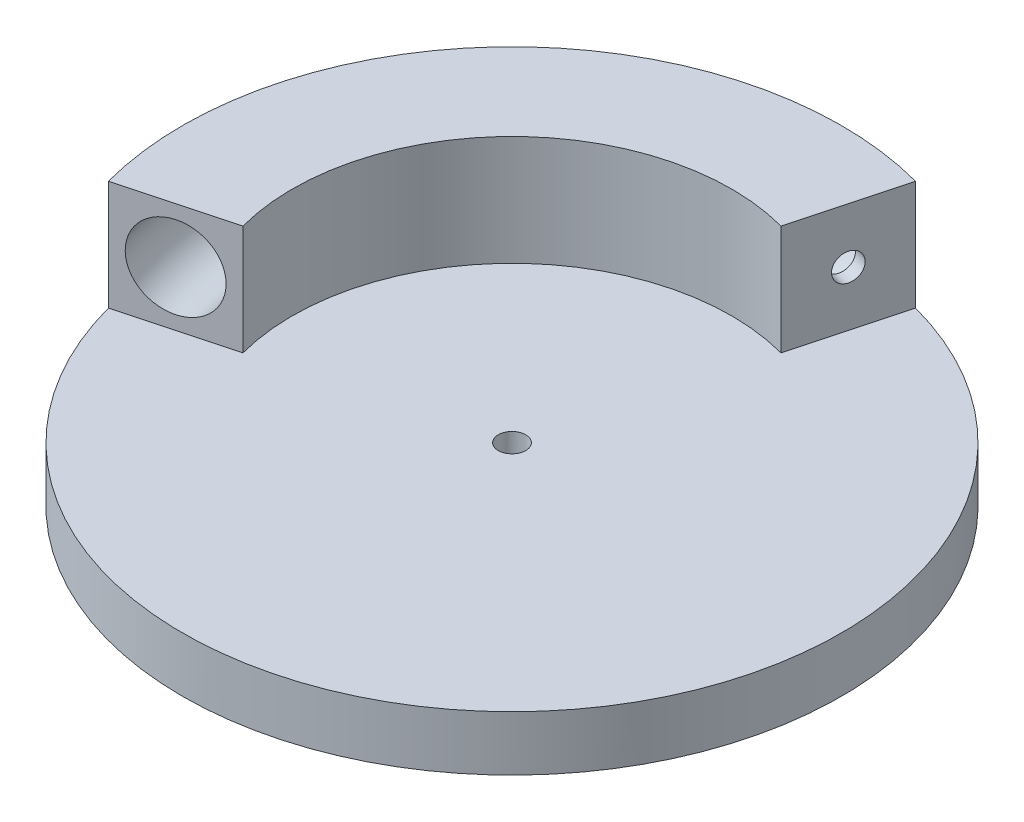
from build123d import *

# Parameters (mm, degrees)
SKETCH1_R                = 38.1
BOSS_EXTRUDE1_DEPTH      = 6.35
BOSS_EXTRUDE2_DEPTH      = 12.7
CUT_REVOLVE1_OUTLINE_R   = 4.7625
CUT_REVOLVE1_START       = -1.5875
CUT_REVOLVE1_2_OUTLINE_W = 11
CUT_REVOLVE1_2_OUTLINE_H = 11
CUT_REVOLVE1_2_DEPTH     = 1.5875
CUT_EXTRUDE2_REACH       = 59.15
SKETCH5_R                = 1.5875
CUT_EXTRUDE3_REACH       = 57.358
SKETCH6_R                = 1.5875


with BuildPart() as part:
    # Sketch1 → Boss-Extrude1 (new body)
    with BuildSketch(Plane(origin=(0, 0, 0), x_dir=(1, 0, 0), z_dir=(0, 1, 0))):
        with Locations(Location((0, 0, 0), (0, 0, 270))):
            Circle(SKETCH1_R)
    extrude(amount=BOSS_EXTRUDE1_DEPTH)

    # Sketch2 → Boss-Extrude2 (add)
    with BuildSketch(Plane(origin=(0, 6.35, 0), x_dir=(1, 0, 0), z_dir=(0, 1, 0))):
        with BuildLine():
            ThreePointArc((9.861005618, 36.801773982), (-26.940768363, 26.940768363), (-36.801773982, -9.861005618))
            Line((-36.801773982, -9.861005618), (-24.534515988, -6.574003746))
            ThreePointArc((-24.534515988, -6.574003746), (-17.960512242, 17.960512242), (6.574003746, 24.534515988))
            Line((6.574003746, 24.534515988), (9.861005618, 36.801773982))
        make_face()
    extrude(amount=BOSS_EXTRUDE2_DEPTH)

    # Cut-Revolve1: read off the stored shape, not the designer's step
    # Cut-Revolve1 outline → Cut-Revolve1 (revolve, cut)
    with BuildSketch(Plane.XY):
        with Locations((31.75, 12.7)):
            Circle(CUT_REVOLVE1_OUTLINE_R)
    revolve(axis=Axis((0, 0, 0), (0, 1, 0)), mode=Mode.SUBTRACT)

    # Cut-Revolve1 2 outline → Cut-Revolve1 2 (add)
    with BuildSketch(Plane(origin=(0, 0, 0), x_dir=(0, 1, 0), z_dir=(0.9659258262890682, 0, 0.2588190451025211)).offset(CUT_REVOLVE1_START)):
        with Locations((12.5, -31.5)):
            Rectangle(CUT_REVOLVE1_2_OUTLINE_W, CUT_REVOLVE1_2_OUTLINE_H)
    extrude(amount=CUT_REVOLVE1_2_DEPTH)

    # Sketch5 → Cut-Extrude2 (cut, up to next)
    with BuildSketch(Plane(origin=(0, 0, 0), x_dir=(0.25881904510252135, 0, -0.9659258262890682), z_dir=(0.9659258262890681, 0, 0.2588190451025213)), mode=Mode.PRIVATE) as cut_extrude2_sk1:
        with Locations((31.75, 12.7)):
            Circle(SKETCH5_R)
    cut_extrude2_tool1 = extrude(cut_extrude2_sk1.sketch, amount=-CUT_EXTRUDE2_REACH, mode=Mode.PRIVATE) & part.part
    add(cut_extrude2_tool1.solids().sort_by_distance((8.217505, 12.7, -30.668145))[0], mode=Mode.SUBTRACT)

    # Sketch6 → Cut-Extrude3 (cut, up to next)
    with BuildSketch(Plane(origin=(0, 6.35, 0), x_dir=(1, 0, 0), z_dir=(0, 1, 0)), mode=Mode.PRIVATE) as cut_extrude3_sk1:
        with Locations(Location((0, 0, 0), (0, 0, 270))):
            Circle(SKETCH6_R)
    cut_extrude3_tool1 = extrude(cut_extrude3_sk1.sketch, amount=-CUT_EXTRUDE3_REACH, mode=Mode.PRIVATE) & part.part
    add(cut_extrude3_tool1.solids().sort_by_distance((0, 6.35, 0))[0], mode=Mode.SUBTRACT)


solid = part.part
